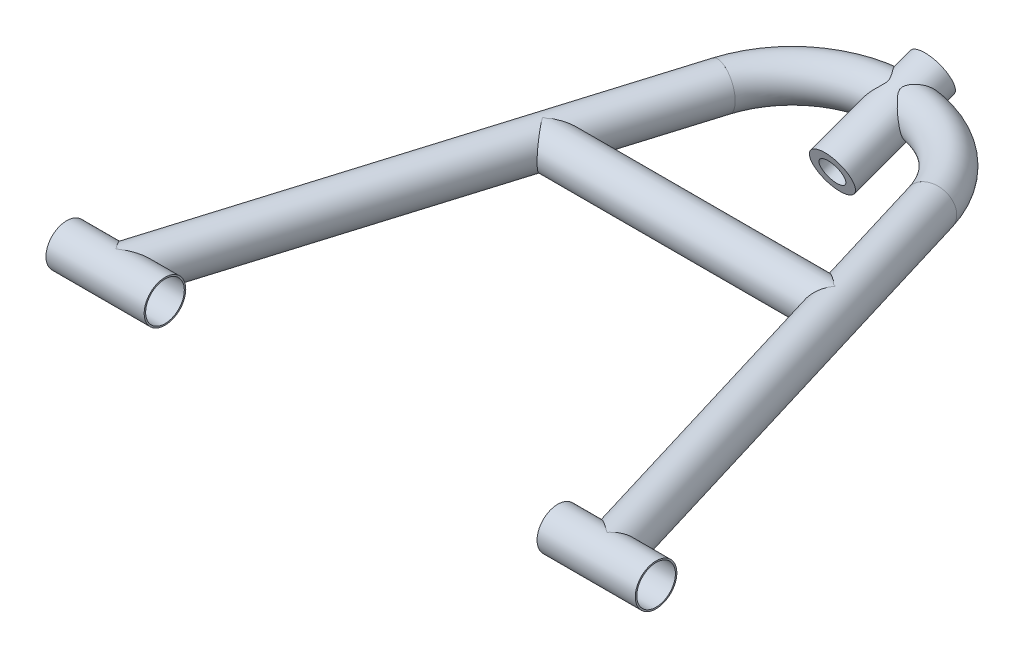
from build123d import *

# Parameters (mm, degrees)
AL_START                                       = 43.458552267
AL_ROUND_TUBING_AL_RND_TUBE_1_OD_X_0_2_R       = 12.7
AL_ROUND_TUBING_AL_RND_TUBE_1_OD_X_0_2_R_2     = 11.811
AL_ROUND_TUBING_AL_RND_TUBE_1_OD_X_0_035_DEPTH = 296.596909623
AL_START_2                                     = 137
AL_ROUND_TUBING_AL_RND_TUBE_1_OD_X_0_3_DEPTH   = 31
AL_ROUND_TUBING_AL_RND_TUBE_1_OD_X_0_4_O_R     = 12.7
AL_ROUND_TUBING_AL_RND_TUBE_1_OD_X_0_4_O_R_2   = 11.811
AL_ROUND_TUBING_AL_RND_TUBE_1_OD_X_0_4_ANGLE   = 73.141601
AL_START_3                                     = 298.075139191
AL_ROUND_TUBING_AL_RND_TUBE_1_OD_X_0_5_O_R     = 12.7
AL_ROUND_TUBING_AL_RND_TUBE_1_OD_X_0_5_O_R_2   = 11.811
AL_ROUND_TUBING_AL_RND_TUBE_1_OD_X_0_5_DEPTH   = 3.556233064
AL_ROUND_TUBING_AL_RND_TUBE_1_OD_X_0_6_O_R     = 12.7
AL_ROUND_TUBING_AL_RND_TUBE_1_OD_X_0_6_O_R_2   = 11.811
AL_ROUND_TUBING_AL_RND_TUBE_1_OD_X_0_6_ANGLE   = 73.141601
AL_START_4                                     = -166.136138572
AL_ROUND_TUBING_AL_RND_TUBE_1_OD_X_0_7_O_R     = 12.7
AL_ROUND_TUBING_AL_RND_TUBE_1_OD_X_0_7_O_R_2   = 11.811
AL_ROUND_TUBING_AL_RND_TUBE_1_OD_X_0_7_DEPTH   = 296.596909624
AL_START_5                                     = 432
AL_ROUND_TUBING_AL_RND_TUBE_1_OD_X_0_8_DEPTH   = 31
AL_START_6                                     = 210.459316229
AL_ROUND_TUBING_AL_RND_TUBE_1_OD_X_0_9_O_R     = 12.7
AL_ROUND_TUBING_AL_RND_TUBE_1_OD_X_0_9_O_R_2   = 11.811
AL_ROUND_TUBING_AL_RND_TUBE_1_OD_X_0_9_DEPTH   = 178.787878988
AL_START_7                                     = 239
AL_ROUND_TUBING_AL_RND_TUBE_1_OD_X_0_10_DEPTH  = 32
AL_START_8                                     = -97
AL_ROUND_TUBING_AL_RND_TUBE_1_OD_X_0_12_DEPTH  = 32
AL_START_9                                     = 419.853255723
AL_ROUND_TUBING_AL_RND_TUBE_1_OD_X_0_15_R      = 12.7
AL_ROUND_TUBING_AL_RND_TUBE_1_OD_X_0_15_R_2    = 11.811
AL_ROUND_TUBING_AL_RND_TUBE_1_OD_X_0_14_DEPTH  = 60
AL_START_10                                    = 119.853255723
AL_ROUND_TUBING_AL_RND_TUBE_1_OD_X_0_17_R      = 12.7
AL_ROUND_TUBING_AL_RND_TUBE_1_OD_X_0_17_R_2    = 11.811
AL_ROUND_TUBING_AL_RND_TUBE_1_OD_X_0_16_DEPTH  = 60
SKETCH12_R                                     = 13.335
SKETCH12_R_2                                   = 7.7978
AL_PIPE_STRUCTURAL_AL_PIPE_STRUCTURAL_0_DEPTH  = 65


with BuildPart() as part:
    # Al round tubing AL RND TUBE 1 OD X 0.035 WALL(1): read off the stored shape, not the designer's step
    # Al round tubing AL RND TUBE 1 OD X 0 2 → Al round tubing AL RND TUBE 1 OD X 0.035 WALL(1) (new body)
    with BuildSketch(Plane(origin=(0, 0, 0), x_dir=(0.9570244044334734, 0, 0.2900073952828711), z_dir=(0.2900073952828711, 0, -0.9570244044334735)).offset(AL_START)):
        with Locations((143.41322281, 0)):
            Circle(AL_ROUND_TUBING_AL_RND_TUBE_1_OD_X_0_2_R)
        with Locations((143.41322281, 0)):
            Circle(AL_ROUND_TUBING_AL_RND_TUBE_1_OD_X_0_2_R_2, mode=Mode.SUBTRACT)
    extrude(amount=AL_ROUND_TUBING_AL_RND_TUBE_1_OD_X_0_035_DEPTH)

    # Al round tubing AL RND TUBE 1 OD X 0 3 o → Al round tubing AL RND TUBE 1 OD X 0 3 (cut)
    with BuildSketch(Plane.YZ.offset(AL_START_2)):
        with BuildLine():
            ThreePointArc((-12.7, 0), (0, -12.7), (12.7, 0))
            Line((12.7, 0), (12.7, 5))
            Line((12.7, 5), (-12.7, 5))
            Line((-12.7, 5), (-12.7, 0))
        make_face()
    extrude(amount=AL_ROUND_TUBING_AL_RND_TUBE_1_OD_X_0_3_DEPTH, mode=Mode.SUBTRACT)


with BuildPart() as body_2:
    # Al round tubing AL RND TUBE 1 OD X 0 4 o → Al round tubing AL RND TUBE 1 OD X 0 4 (revolve)
    with BuildSketch(Plane(origin=(298.075139191, 0, -265), x_dir=(0, 0, -1), z_dir=(1, 0, 0))):
        with Locations((65, 0)):
            Circle(AL_ROUND_TUBING_AL_RND_TUBE_1_OD_X_0_4_O_R)
        with Locations((65, 0)):
            Circle(AL_ROUND_TUBING_AL_RND_TUBE_1_OD_X_0_4_O_R_2, mode=Mode.SUBTRACT)
    revolve(axis=Axis((298.075139191, 0, -265), (0, 1, 0)), revolution_arc=AL_ROUND_TUBING_AL_RND_TUBE_1_OD_X_0_4_ANGLE)


with BuildPart() as body_3:
    # Al round tubing AL RND TUBE 1 OD X 0 5 o → Al round tubing AL RND TUBE 1 OD X 0 5 (new body)
    with BuildSketch(Plane.YZ.offset(AL_START_3)):
        with Locations((0, -330)):
            Circle(AL_ROUND_TUBING_AL_RND_TUBE_1_OD_X_0_5_O_R)
        with Locations((0, -330)):
            Circle(AL_ROUND_TUBING_AL_RND_TUBE_1_OD_X_0_5_O_R_2, mode=Mode.SUBTRACT)
    extrude(amount=AL_ROUND_TUBING_AL_RND_TUBE_1_OD_X_0_5_DEPTH)


with BuildPart() as body_4:
    # Al round tubing AL RND TUBE 1 OD X 0 6 o → Al round tubing AL RND TUBE 1 OD X 0 6 (revolve)
    with BuildSketch(Plane(origin=(301.631372255, 0, -265), x_dir=(0.9570244044334761, 0, -0.29000739528286223), z_dir=(0.29000739528286223, 0, 0.9570244044334761))):
        with Locations((65, 0)):
            Circle(AL_ROUND_TUBING_AL_RND_TUBE_1_OD_X_0_6_O_R)
        with Locations((65, 0)):
            Circle(AL_ROUND_TUBING_AL_RND_TUBE_1_OD_X_0_6_O_R_2, mode=Mode.SUBTRACT)
    revolve(axis=Axis((301.631372255, 0, -265), (0, 1, 0)), revolution_arc=AL_ROUND_TUBING_AL_RND_TUBE_1_OD_X_0_6_ANGLE)


with BuildPart() as body_5:
    # Al round tubing AL RND TUBE 1 OD X 0 7 o → Al round tubing AL RND TUBE 1 OD X 0 7 (new body)
    with BuildSketch(Plane(origin=(0, 0, 0), x_dir=(0.9570244044334735, 0, -0.29000739528287095), z_dir=(0.2900073952828709, 0, 0.9570244044334736)).offset(AL_START_4)):
        with Locations((430.52054414, 0)):
            Circle(AL_ROUND_TUBING_AL_RND_TUBE_1_OD_X_0_7_O_R)
        with Locations((430.52054414, 0)):
            Circle(AL_ROUND_TUBING_AL_RND_TUBE_1_OD_X_0_7_O_R_2, mode=Mode.SUBTRACT)
    extrude(amount=AL_ROUND_TUBING_AL_RND_TUBE_1_OD_X_0_7_DEPTH)

    # Al round tubing AL RND TUBE 1 OD X 0 8 o → Al round tubing AL RND TUBE 1 OD X 0 8 (cut)
    with BuildSketch(Plane.YZ.offset(AL_START_5)):
        with BuildLine():
            ThreePointArc((-12.7, 0), (0, -12.7), (12.7, 0))
            Line((12.7, 0), (12.7, 5))
            Line((12.7, 5), (-12.7, 5))
            Line((-12.7, 5), (-12.7, 0))
        make_face()
    extrude(amount=AL_ROUND_TUBING_AL_RND_TUBE_1_OD_X_0_8_DEPTH, mode=Mode.SUBTRACT)


with BuildPart() as body_6:
    # Al round tubing AL RND TUBE 1 OD X 0 9 o → Al round tubing AL RND TUBE 1 OD X 0 9 (new body)
    with BuildSketch(Plane.YZ.offset(AL_START_6)):
        with Locations((0, -200)):
            Circle(AL_ROUND_TUBING_AL_RND_TUBE_1_OD_X_0_9_O_R)
        with Locations((0, -200)):
            Circle(AL_ROUND_TUBING_AL_RND_TUBE_1_OD_X_0_9_O_R_2, mode=Mode.SUBTRACT)
    extrude(amount=AL_ROUND_TUBING_AL_RND_TUBE_1_OD_X_0_9_DEPTH)

    # Al round tubing AL RND TUBE 1 OD X 0 11 → Al round tubing AL RND TUBE 1 OD X 0 10 (cut)
    with BuildSketch(Plane(origin=(0, 0, 0), x_dir=(0.9570244044334734, 0, 0.2900073952828711), z_dir=(0.2900073952828711, 0, -0.9570244044334735)).offset(AL_START_7)):
        with BuildLine():
            ThreePointArc((143.41322281, -12.7), (156.11322281, 0), (143.41322281, 12.7))
            Line((143.41322281, 12.7), (138, 12.7))
            Line((138, 12.7), (138, -12.7))
            Line((138, -12.7), (143.41322281, -12.7))
        make_face()
    extrude(amount=AL_ROUND_TUBING_AL_RND_TUBE_1_OD_X_0_10_DEPTH, mode=Mode.SUBTRACT)

    # Al round tubing AL RND TUBE 1 OD X 0 13 → Al round tubing AL RND TUBE 1 OD X 0 12 (cut)
    with BuildSketch(Plane(origin=(0, 0, 0), x_dir=(0.9570244044334735, 0, -0.29000739528287095), z_dir=(0.2900073952828709, 0, 0.9570244044334736)).offset(AL_START_8)):
        with BuildLine():
            ThreePointArc((430.52054414, 12.7), (417.82054414, 0), (430.52054414, -12.7))
            Line((430.52054414, -12.7), (436, -12.7))
            Line((436, -12.7), (436, 12.7))
            Line((436, 12.7), (430.52054414, 12.7))
        make_face()
    extrude(amount=AL_ROUND_TUBING_AL_RND_TUBE_1_OD_X_0_12_DEPTH, mode=Mode.SUBTRACT)


with BuildPart() as body_7:
    # Al round tubing AL RND TUBE 1 OD X 0 15 → Al round tubing AL RND TUBE 1 OD X 0 14 (new body)
    with BuildSketch(Plane.YZ.offset(AL_START_9)):
        Circle(AL_ROUND_TUBING_AL_RND_TUBE_1_OD_X_0_15_R)
        Circle(AL_ROUND_TUBING_AL_RND_TUBE_1_OD_X_0_15_R_2, mode=Mode.SUBTRACT)
    extrude(amount=AL_ROUND_TUBING_AL_RND_TUBE_1_OD_X_0_14_DEPTH)


with BuildPart() as body_8:
    # Al round tubing AL RND TUBE 1 OD X 0 17 → Al round tubing AL RND TUBE 1 OD X 0 16 (new body)
    with BuildSketch(Plane.YZ.offset(AL_START_10)):
        Circle(AL_ROUND_TUBING_AL_RND_TUBE_1_OD_X_0_17_R)
        Circle(AL_ROUND_TUBING_AL_RND_TUBE_1_OD_X_0_17_R_2, mode=Mode.SUBTRACT)
    extrude(amount=AL_ROUND_TUBING_AL_RND_TUBE_1_OD_X_0_16_DEPTH)


with BuildPart() as body_9:
    # Sketch12 → Al pipe structural AL PIPE STRUCTURAL 0.75 S160(2) (new body)
    with BuildSketch(Plane(origin=(299.853255723, 6.857060038, -348.787781339), x_dir=(1, 0, 0), z_dir=(6.832141690000967e-15, -0.3428530019234573, 0.9393890669323727))):
        Circle(SKETCH12_R)
        Circle(SKETCH12_R_2, mode=Mode.SUBTRACT)
    extrude(amount=AL_PIPE_STRUCTURAL_AL_PIPE_STRUCTURAL_0_DEPTH)


solid = Compound([part.part, body_2.part, body_3.part, body_4.part, body_5.part, body_6.part, body_7.part, body_8.part, body_9.part])
